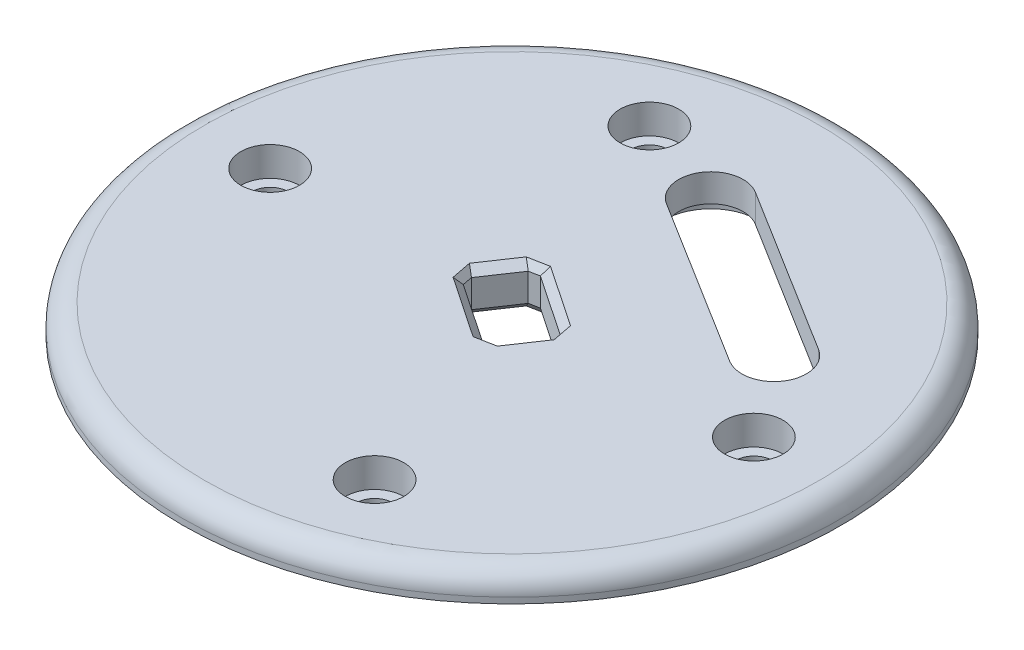
from build123d import *
from build123d.topology import SkipClean

# Parameters (mm, degrees)
SKETCH1_R           = 22.5
BOSS_EXTRUDE1_DEPTH = 1.9
SKETCH2_R           = 1.25
CUT_EXTRUDE1_DEPTH  = 32.876480358
CUT_EXTRUDE2_DEPTH  = 3
SKETCH5_R           = 2
BOSS_EXTRUDE2_DEPTH = 1
SKETCH6_R           = 2
CUT_EXTRUDE3_DEPTH  = 2
FILLET2_R           = 1.5
SKETCH7_R           = 2.5
SKETCH7_R_2         = 1.25
BOSS_EXTRUDE3_DEPTH = 1.1
CHAMFER2_SIZE       = 0.55
BOSS_EXTRUDE4_START = 0.9
SKETCH10_R          = 2
SKETCH10_R_2        = 1.25
BOSS_EXTRUDE4_DEPTH = 0.9
CUT_EXTRUDE4_DEPTH  = 33.070235422
CHAMFER3_SIZE       = 0.5


with BuildPart() as part:
    # Sketch1 → Boss-Extrude1 (new body)
    with BuildSketch(Plane(origin=(0, 0, 0), x_dir=(1, 0, 0), z_dir=(0, 1, 0))):
        with Locations(Location((0, 0, 0), (0, 0, 90))):
            Circle(SKETCH1_R)
    extrude(amount=BOSS_EXTRUDE1_DEPTH)

    # Sketch2 → Cut-Extrude1 (cut, through all)
    with BuildSketch(Plane.XZ):
        with Locations(Location((16.199395554, -0.312653275, 0), (0, 0, 270))):
            Circle(SKETCH2_R)
        with Locations(Location((-5.762032101, -15.143217553, 0), (0, 0, 270))):
            Circle(SKETCH2_R)
        with Locations(Location((-16.199392803, 0.312657063, 0), (0, 0, 270))):
            Circle(SKETCH2_R)
        with Locations(Location((5.762036646, 15.143220658, 0), (0, 0, 270))):
            Circle(SKETCH2_R)
    extrude(amount=-CUT_EXTRUDE1_DEPTH, mode=Mode.SUBTRACT)

    # Sketch3 → Cut-Extrude2 (cut)
    with BuildSketch(Plane(origin=(0, 1.9, 0), x_dir=(1, 0, 0), z_dir=(0, 1, 0))):
        with BuildLine():
            Line((-0.566479918, 11.117262385), (10.889757234, 3.975509775))
            ThreePointArc((10.889757234, 3.975509775), (13.92054075, 4.67861096), (13.217439566, 7.709394476))
            Line((13.217439566, 7.709394476), (1.761202414, 14.851147086))
            ThreePointArc((1.761202414, 14.851147086), (-1.269581102, 14.148045901), (-0.566479918, 11.117262385))
        make_face()
    extrude(amount=-CUT_EXTRUDE2_DEPTH, mode=Mode.SUBTRACT)

    # Sketch5 → Boss-Extrude2 (add)
    with BuildSketch(Plane.XZ):
        with BuildLine():
            ThreePointArc((-17.179194793, 8.795752741), (-16.857328224, 9.81864057), (-16.891461695, 10.890429965))
            Line((-16.891461695, 10.890429965), (-17.314006113, 12.972955453))
            Line((-17.314006113, 12.972955453), (-5.575167705, 20.900200554))
            Line((-5.575167705, 20.900200554), (-3.772911963, 19.726806718))
            ThreePointArc((-3.772911963, 19.726806718), (-2.798329578, 19.30288327), (-1.738658435, 19.221526132))
            ThreePointArc((-1.738658435, 19.221526132), (10.800253719, -15.9951405), (-17.179194793, 8.795752741))
        make_face()
        with Locations(Location((-5.762032101, -15.143217553, 0), (0, 0, 270))):
            Circle(SKETCH5_R, mode=Mode.SUBTRACT)
        with Locations(Location((16.199395554, -0.312653275, 0), (0, 0, 270))):
            Circle(SKETCH5_R, mode=Mode.SUBTRACT)
        with Locations(Location((5.762036647, 15.143220658, 0), (0, 0, 270))):
            Circle(SKETCH5_R, mode=Mode.SUBTRACT)
        with Locations(Location((-16.199392803, 0.312657063, 0), (0, 0, 270))):
            Circle(SKETCH5_R, mode=Mode.SUBTRACT)
        with BuildLine():
            ThreePointArc((-1.095498629, -10.268652225), (-2.118191262, -14.677064613), (2.290221126, -15.699757245))
            Line((2.290221126, -15.699757245), (13.746458277, -8.558004636))
            ThreePointArc((13.746458277, -8.558004636), (14.76915091, -4.149592248), (10.360738522, -3.126899616))
            Line((10.360738522, -3.126899616), (-1.095498629, -10.268652225))
        make_face(mode=Mode.SUBTRACT)
    extrude(amount=BOSS_EXTRUDE2_DEPTH)

    # Sketch6 → Cut-Extrude3 (cut)
    with SkipClean():  # the faces are left unmerged after this step: merging them gives an invalid solid
        with BuildSketch(Plane(origin=(0, 1.9, 0), x_dir=(1, 0, 0), z_dir=(0, 1, 0))):
            with Locations(Location((-16.199392803, -0.312657063, 0), (0, 0, 270))):
                Circle(SKETCH6_R)
            with Locations(Location((-5.762030762, 15.143217579, 0), (0, 0, 270))):
                Circle(SKETCH6_R)
            with Locations(Location((5.762036646, -15.143220658, 0), (0, 0, 270.000000006))):
                Circle(SKETCH6_R)
            with Locations(Location((16.199395554, 0.312653275, 0), (0, 0, 270))):
                Circle(SKETCH6_R)
        extrude(amount=-CUT_EXTRUDE3_DEPTH, mode=Mode.SUBTRACT)
    add(part.part.scale(1), mode=Mode.REPLACE)  # the faces are merged on a copy

    # Fillet2
    fillet2_edges = [part.edges().sort_by_distance(p)[0] for p in [
        (0, 1.9, 22.5),
    ]]
    fillet(fillet2_edges, radius=FILLET2_R)

    # Sketch7 → Boss-Extrude3 (add)
    # profile 1 of 4: a face of its own
    with BuildSketch(Plane.XZ.offset(1)):
        with Locations(Location((-16.199392803, 0.312657063, 0), (0, 0, 270))):
            Circle(SKETCH7_R)
        with Locations(Location((-16.199392803, 0.312657063, 0), (0, 0, 270))):
            Circle(SKETCH7_R_2, mode=Mode.SUBTRACT)
    # profile 2 of 4: a face of its own
    with BuildSketch(Plane.XZ.offset(1)):
        with Locations(Location((5.762036647, 15.143220658, 0), (0, 0, 270))):
            Circle(SKETCH7_R)
        with Locations(Location((5.762036647, 15.143220658, 0), (0, 0, 270))):
            Circle(SKETCH7_R_2, mode=Mode.SUBTRACT)
    # profile 3 of 4: a face of its own
    with BuildSketch(Plane.XZ.offset(1)):
        with Locations(Location((16.199395554, -0.312653275, 0), (0, 0, 270))):
            Circle(SKETCH7_R)
        with Locations(Location((16.199395554, -0.312653275, 0), (0, 0, 270))):
            Circle(SKETCH7_R_2, mode=Mode.SUBTRACT)
    # profile 4 of 4: a face of its own
    with BuildSketch(Plane.XZ.offset(1)):
        with Locations(Location((-5.762032101, -15.143217553, 0), (0, 0, 270))):
            Circle(SKETCH7_R)
        with Locations(Location((-5.762032101, -15.143217553, 0), (0, 0, 270))):
            Circle(SKETCH7_R_2, mode=Mode.SUBTRACT)
    extrude(amount=BOSS_EXTRUDE3_DEPTH)

    # Chamfer2
    chamfer2_edges = [part.edges().sort_by_distance(p)[0] for p in [
        (-16.199392803, -2.1, 2.812657063),
        (-16.199392803, -1, 2.812657063),
        (5.762036647, -2.1, 17.643220658),
        (5.762036647, -1, 17.643220658),
        (16.199395554, -2.1, 2.187346725),
        (16.199395554, -1, 2.187346725),
        (-5.762032101, -2.1, -12.643217553),
        (-5.762032101, -1, -12.643217553),
    ]]
    chamfer(chamfer2_edges, length=CHAMFER2_SIZE - 0.0001)  # a hair under: the kernel refuses the full size

    # Sketch10 → Boss-Extrude4 (add)
    # profile 1 of 4: a face of its own
    with BuildSketch(Plane(origin=(0, -1, 0), x_dir=(1, 0, 0), z_dir=(0, 1, 0)).offset(BOSS_EXTRUDE4_START)):
        with Locations(Location((-5.762032101, 15.143217553, 0), (0, 0, 270))):
            Circle(SKETCH10_R)
        with Locations(Location((-5.762032101, 15.143217553, 0), (0, 0, 270))):
            Circle(SKETCH10_R_2, mode=Mode.SUBTRACT)
    # profile 2 of 4: a face of its own
    with BuildSketch(Plane(origin=(0, -1, 0), x_dir=(1, 0, 0), z_dir=(0, 1, 0)).offset(BOSS_EXTRUDE4_START)):
        with Locations(Location((5.762036647, -15.143220658, 0), (0, 0, 270))):
            Circle(SKETCH10_R)
        with Locations(Location((5.762036647, -15.143220658, 0), (0, 0, 270))):
            Circle(SKETCH10_R_2, mode=Mode.SUBTRACT)
    # profile 3 of 4: a face of its own
    with BuildSketch(Plane(origin=(0, -1, 0), x_dir=(1, 0, 0), z_dir=(0, 1, 0)).offset(BOSS_EXTRUDE4_START)):
        with Locations(Location((16.199395554, 0.312653275, 0), (0, 0, 270))):
            Circle(SKETCH10_R)
        with Locations(Location((16.199395554, 0.312653275, 0), (0, 0, 270))):
            Circle(SKETCH10_R_2, mode=Mode.SUBTRACT)
    # profile 4 of 4: a face of its own
    with BuildSketch(Plane(origin=(0, -1, 0), x_dir=(1, 0, 0), z_dir=(0, 1, 0)).offset(BOSS_EXTRUDE4_START)):
        with Locations(Location((-16.199392803, -0.312657063, 0), (0, 0, 270))):
            Circle(SKETCH10_R)
        with Locations(Location((-16.199392803, -0.312657063, 0), (0, 0, 270))):
            Circle(SKETCH10_R_2, mode=Mode.SUBTRACT)
    extrude(amount=-BOSS_EXTRUDE4_DEPTH)

    # Sketch11 → Cut-Extrude4 (cut, through all)
    with BuildSketch(Plane(origin=(0, 1.9, 0), x_dir=(1, 0, 0), z_dir=(0, 1, 0))):
        Polygon((1.366935798, -3.196360259), (-3.654112636, 0.191121747), (-1.532974971, 3.335148765), (3.488073463, -0.052333241), align=None)
    extrude(amount=-CUT_EXTRUDE4_DEPTH, mode=Mode.SUBTRACT)

    # Chamfer3
    chamfer3_edges = [part.edges().sort_by_distance(p)[0] for p in [
        (0.977549246, -1, -1.641407762),
        (-2.593543803, -1, -1.763135256),
        (-1.143588419, -1, 1.502619256),
        (2.42750463, -1, 1.62434675),
        (3.488073463, 0.45, 0.052333241),
        (1.366935798, 0.45, 3.196360259),
        (-3.654112636, 0.45, -0.191121747),
        (-1.532974971, 0.45, -3.335148765),
        (2.42750463, 1.9, 1.62434675),
        (0.977549246, 1.9, -1.641407762),
        (-2.593543803, 1.9, -1.763135256),
        (-1.143588419, 1.9, 1.502619256),
    ]]
    chamfer(chamfer3_edges, length=CHAMFER3_SIZE)


solid = part.part
